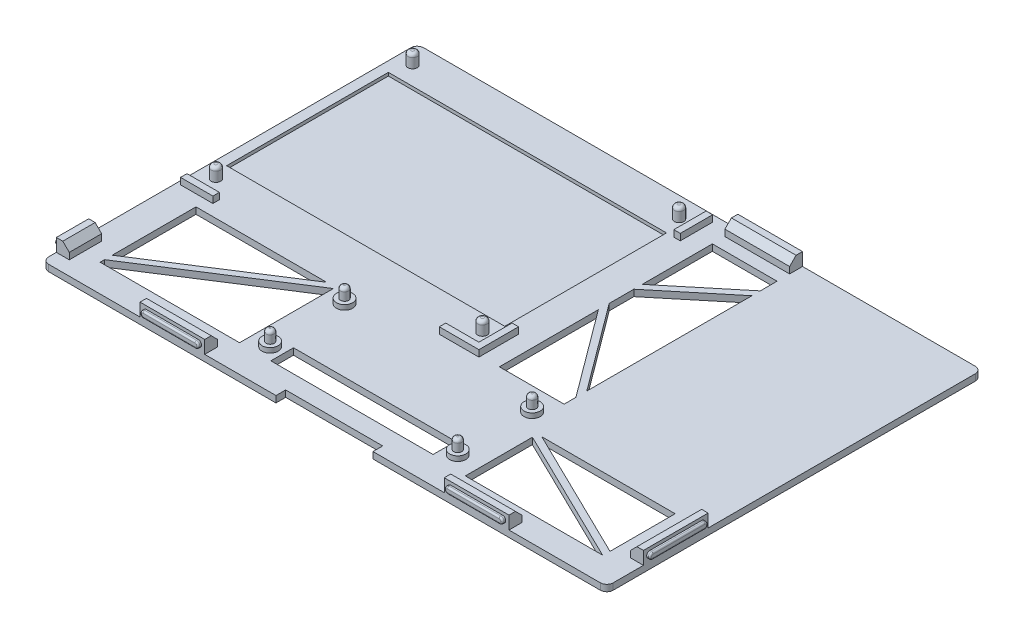
from build123d import *

# Parameters (mm, degrees)
SKETCH_1_W          = 174.55
SKETCH_1_H          = 115.95
EXTRUDE_1_DEPTH     = 2
SKETCH_3_W          = 2
SKETCH_3_H          = 10
SKETCH_3_W_2        = 10
SKETCH_3_H_2        = 2
EXTRUDE_2_DEPTH     = 2
SKETCH_4_R          = 1.45
EXTRUDE_3_DEPTH     = 4
FILLET_2_R          = 1
SKETCH_5_W          = 86
SKETCH_5_H          = 50
CUT_EXTRUDE_1_DEPTH = 1
SKETCH_8_R          = 2.5
EXTRUDE_4_DEPTH     = 1.5
SKETCH_8_3_R        = 1.25
EXTRUDE_5_DEPTH     = 5
FILLET_3_R          = 1
SKETCH_9_W          = 50.159646102
SKETCH_9_H          = 7
SKETCH_9_W_2        = 30
SKETCH_9_H_2        = 3
CUT_EXTRUDE_2_DEPTH = 2
SKETCH_10_W         = 20
SKETCH_10_H         = 4
SKETCH_10_W_2       = 4
SKETCH_10_H_2       = 20
SKETCH_10_H_3       = 10
EXTRUDE_6_DEPTH     = 4
CUT_EXTRUDE_3_DEPTH = 105.895310906
FILLET_1_R          = 2
CHAMFER_1_SIZE      = 2
EXTRUDE_8_DEPTH     = 1
EXTRUDE_9_DEPTH     = 1
EXTRUDE_11_DEPTH    = 1
EXTRUDE_12_DEPTH    = 1
FILLET_4_R          = 0.5


with BuildPart() as part:
    # 草圖1 → 填料-伸長1 (new body)
    with BuildSketch(Plane(origin=(0, 0, 0), x_dir=(1, 0, 0), z_dir=(0, 1, 0))):
        Rectangle(SKETCH_1_W, SKETCH_1_H)
    extrude(amount=EXTRUDE_1_DEPTH)

    # 草圖3 → 填料-伸長2 (add)
    with BuildSketch(Plane(origin=(0, 2, 0), x_dir=(1, 0, 0), z_dir=(0, 1, 0))):
        with Locations((5.09, 50.93)):
            Rectangle(SKETCH_3_W, SKETCH_3_H)
        Polygon((4.09, -14.07), (4.09, -4.07), (6.09, -4.07), (6.09, -14.07), (6.09, -15.07), (6.09, -16.32), (-6.16, -16.32), (-6.16, -14.32), (4.09, -14.32), align=None)
        with Locations((-81.16, -15.32)):
            Rectangle(SKETCH_3_W_2, SKETCH_3_H_2)
    extrude(amount=EXTRUDE_2_DEPTH)

    # 草圖4 → 填料-伸長3 (add)
    with BuildSketch(Plane(origin=(0, 2, 0), x_dir=(1, 0, 0), z_dir=(0, 1, 0))):
        with Locations((0.04, 51.63)):
            Circle(SKETCH_4_R)
        with Locations((0.04, -9.17)):
            Circle(SKETCH_4_R)
        with Locations((-82.36, -9.17)):
            Circle(SKETCH_4_R)
        with Locations((-82.36, 51.63)):
            Circle(SKETCH_4_R)
    extrude(amount=EXTRUDE_3_DEPTH)

    # 圓角2
    fillet_2_edges = [part.edges().sort_by_distance(p)[0] for p in [
        (-83.81, 6, -51.63),
        (-83.81, 6, 9.17),
        (-1.41, 6, 9.17),
        (-1.41, 6, -51.63),
    ]]
    fillet(fillet_2_edges, radius=FILLET_2_R)

    # 草圖5 → 除料-伸長1 (cut)
    with BuildSketch(Plane(origin=(0, 2, 0), x_dir=(1, 0, 0), z_dir=(0, 1, 0))):
        with Locations((-41.16, 20.93)):
            Rectangle(SKETCH_5_W, SKETCH_5_H)
    extrude(amount=-CUT_EXTRUDE_1_DEPTH, mode=Mode.SUBTRACT)

    # 草圖8 → 填料-伸長4 (add)
    with BuildSketch(Plane(origin=(0, 2, 0), x_dir=(1, 0, 0), z_dir=(0, 1, 0))):
        with Locations((29, -22.775)):
            Circle(SKETCH_8_R)
        with Locations((29, -45.775)):
            Circle(SKETCH_8_R)
        with Locations((-29, -45.775)):
            Circle(SKETCH_8_R)
        with Locations((-29, -22.775)):
            Circle(SKETCH_8_R)
    extrude(amount=EXTRUDE_4_DEPTH)

    # 草圖8<3> → 填料-伸長5 (add)
    with BuildSketch(Plane(origin=(0, 2, 0), x_dir=(1, 0, 0), z_dir=(0, 1, 0))):
        with Locations((29, -22.775)):
            Circle(SKETCH_8_3_R)
        with Locations((29, -45.775)):
            Circle(SKETCH_8_3_R)
        with Locations((-29, -45.775)):
            Circle(SKETCH_8_3_R)
        with Locations((-29, -22.775)):
            Circle(SKETCH_8_3_R)
    extrude(amount=EXTRUDE_5_DEPTH)

    # 圓角3
    fillet_3_edges = [part.edges().sort_by_distance(p)[0] for p in [
        (-30.25, 7, 45.775),
        (27.75, 7, 45.775),
        (27.75, 7, 22.775),
        (-30.25, 7, 22.775),
    ]]
    fillet(fillet_3_edges, radius=FILLET_3_R)

    # 草圖9 → 除料-伸長2 (cut)
    with BuildSketch(Plane(origin=(0, 2, 0), x_dir=(1, 0, 0), z_dir=(0, 1, 0))):
        with Locations((0, -45.975)):
            Rectangle(SKETCH_9_W, SKETCH_9_H)
        with Locations((0, -56.475)):
            Rectangle(SKETCH_9_W_2, SKETCH_9_H_2)
    extrude(amount=-CUT_EXTRUDE_2_DEPTH, mode=Mode.SUBTRACT)

    # 草圖10 → 填料-伸長6 (add)
    with BuildSketch(Plane(origin=(0, 2, 0), x_dir=(1, 0, 0), z_dir=(0, 1, 0))):
        with Locations((21.854715439, 55.975)):
            Rectangle(SKETCH_10_W, SKETCH_10_H)
        with Locations((85.275, -36.637998684)):
            Rectangle(SKETCH_10_W_2, SKETCH_10_H_2)
        with Locations((47.031889085, -55.975)):
            Rectangle(SKETCH_10_W, SKETCH_10_H)
        with Locations((-47.031889085, -55.975)):
            Rectangle(SKETCH_10_W, SKETCH_10_H)
        with Locations((-85.275, -48.6)):
            Rectangle(SKETCH_10_W_2, SKETCH_10_H_3)
    extrude(amount=EXTRUDE_6_DEPTH)

    # 草圖11 → 除料-伸長3 (cut, through all)
    with BuildSketch(Plane(origin=(0, 2, 0), x_dir=(1, 0, 0), z_dir=(0, 1, 0))):
        Polygon((-77.879578173, -45.722583606), (-37.497069547, -19.823892626), (-77.879578173, -19.823892626), align=None)
        Polygon((-77.879578173, -49.467196386), (-34.764514275, -49.467196386), (-34.764514275, -20.447382192), (-77.879578173, -48.098554803), align=None)
        Polygon((31.854715439, 44.917489498), (11.854715439, 28.410289152), (11.854715439, 50.090728689), (31.854715439, 50.090728689), align=None)
        Polygon((11.854715439, -15.752914676), (31.854715439, -15.752914676), (31.854715439, -12.091582027), (11.854715439, 14.843632999), align=None)
        Polygon((11.854715439, 25.817052443), (31.854715439, 42.324252788), (31.854715439, -8.736726131), (11.854715439, 18.198488896), align=None)
        Polygon((78.359380095, -48.062791021), (37.115806701, -27.915068386), (78.359380095, -27.915068386), align=None)
        Polygon((35.80419089, -29.5002187), (35.80419089, -50.229107424), (78.237445455, -50.229107424), align=None)
    extrude(amount=-CUT_EXTRUDE_3_DEPTH, mode=Mode.SUBTRACT)

    # 圓角1
    fillet_1_edges = [part.edges().sort_by_distance(p)[0] for p in [
        (87.275, 1, -57.975),
        (-87.275, 1, -57.975),
        (-87.275, 1, 57.975),
        (87.275, 1, 57.975),
    ]]
    fillet(fillet_1_edges, radius=FILLET_1_R)

    # 導角1
    chamfer_1_edges = [part.edges().sort_by_distance(p)[0] for p in [
        (83.275, 6, 36.637998684),
        (47.031889085, 6, 53.975),
        (-47.031889085, 6, 53.975),
        (-83.275, 6, 48.6),
        (21.854715439, 6, -53.975),
    ]]
    chamfer(chamfer_1_edges, length=CHAMFER_1_SIZE)

    # 草圖13 → 填料-伸長8 (add)
    with BuildSketch(Plane(origin=(87.275, 0, 0), x_dir=(0, 0, -1), z_dir=(1, 0, 0))):
        with BuildLine():
            Line((-44.637998684, 5), (-28.637998684, 5))
            ThreePointArc((-28.637998684, 5), (-27.637998684, 4), (-28.637998684, 3))
            Line((-28.637998684, 3), (-44.637998684, 3))
            ThreePointArc((-44.637998684, 3), (-45.637998684, 4), (-44.637998684, 5))
        make_face()
    extrude(amount=EXTRUDE_8_DEPTH)

    # 草圖14 → 填料-伸長9 (add)
    with BuildSketch(Plane(origin=(0, 0, -57.975), x_dir=(-1, 0, 0), z_dir=(0, 0, -1))):
        with BuildLine():
            Line((-29.854715439, 5), (-13.854715439, 5))
            ThreePointArc((-13.854715439, 5), (-12.854715439, 4), (-13.854715439, 3))
            Line((-13.854715439, 3), (-29.854715439, 3))
            ThreePointArc((-29.854715439, 3), (-30.854715439, 4), (-29.854715439, 5))
        make_face()
    extrude(amount=EXTRUDE_9_DEPTH)

    # 草圖15 → 填料-伸長11 (add)
    with BuildSketch(Plane.XY.offset(57.975)):
        with BuildLine():
            Line((-55.031889085, 5), (-39.031889085, 5))
            ThreePointArc((-39.031889085, 5), (-38.031889085, 4), (-39.031889085, 3))
            Line((-39.031889085, 3), (-55.031889085, 3))
            ThreePointArc((-55.031889085, 3), (-56.031889085, 4), (-55.031889085, 5))
        make_face()
        with BuildLine():
            Line((55.031889085, 5), (39.031889085, 5))
            ThreePointArc((39.031889085, 5), (38.031889085, 4), (39.031889085, 3))
            Line((39.031889085, 3), (55.031889085, 3))
            ThreePointArc((55.031889085, 3), (56.031889085, 4), (55.031889085, 5))
        make_face()
    extrude(amount=EXTRUDE_11_DEPTH)

    # 草圖16 → 填料-伸長12 (add)
    with BuildSketch(Plane.ZY.offset(87.275)):
        with BuildLine():
            Line((45.1, 5), (52.1, 5))
            ThreePointArc((52.1, 5), (53.1, 4), (52.1, 3))
            Line((52.1, 3), (45.1, 3))
            ThreePointArc((45.1, 3), (44.1, 4), (45.1, 5))
        make_face()
    extrude(amount=EXTRUDE_12_DEPTH)

    # 圓角4
    fillet_4_edges = [part.edges().sort_by_distance(p)[0] for p in [
        (12.854715439, 4, -58.975),
        (21.854715439, 3, -58.975),
        (30.854715439, 4, -58.975),
        (88.275, 4, 27.637998684),
        (88.275, 3, 36.637998684),
        (88.275, 4, 45.637998684),
        (56.031889085, 4, 58.975),
        (47.031889085, 3, 58.975),
        (38.031889085, 4, 58.975),
        (-88.275, 4, 53.1),
        (-88.275, 3, 48.6),
        (-88.275, 4, 44.1),
        (-38.031889085, 4, 58.975),
        (-47.031889085, 3, 58.975),
        (-56.031889085, 4, 58.975),
        (21.854715439, 5, -58.975),
        (88.275, 5, 36.637998684),
        (47.031889085, 5, 58.975),
        (-88.275, 5, 48.6),
        (-47.031889085, 5, 58.975),
    ]]
    fillet(fillet_4_edges, radius=FILLET_4_R)


solid = part.part
